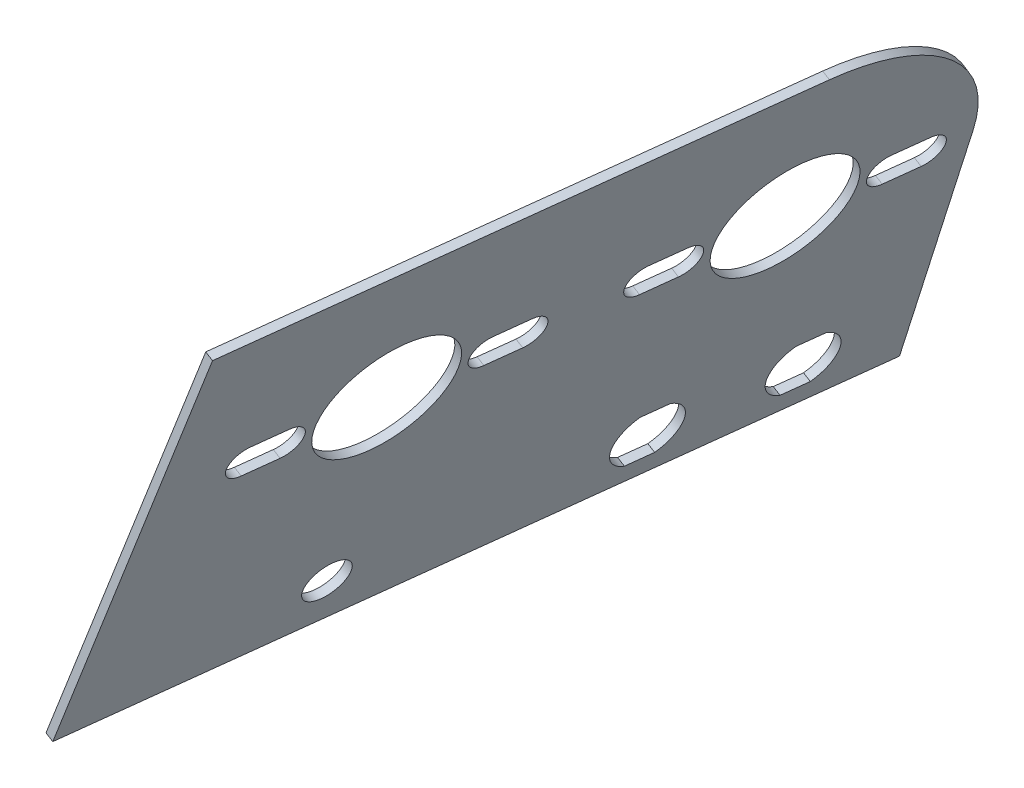
from build123d import *

# Parameters (mm, degrees)
SKETCH39_R          = 11.90625
SKETCH39_R_2        = 4.024999951
BOSS_EXTRUDE1_DEPTH = 1.5875


with BuildPart() as part:
    # Sketch39 → Boss-Extrude1 (new body)
    with BuildSketch(Plane(origin=(-441.521969452, 172.104793819, -62.182961286), x_dir=(-0.12122181659134341, 0.04725213510134498, 0.9915001295565519), z_dir=(-0.9237984742451071, 0.3600956621414251, -0.1301056996804562))):
        with BuildLine():
            Line((-228.044977909, 213.495528257), (-90.363815922, 201.963804234))
            Line((-90.363815922, 201.963804234), (-90.363815922, 283.724086083))
            Line((-90.363815922, 283.724086083), (-190.676741831, 292.125968815))
            ThreePointArc((-190.676741831, 292.125968815), (-213.041445426, 284.983204878), (-223.80498218, 264.11827449))
            Line((-223.80498218, 264.11827449), (-228.044977909, 213.495528257))
        make_face()
        with Locations((-128.463815922, 256.132810093)):
            Circle(SKETCH39_R, mode=Mode.SUBTRACT)
        with Locations((-193.237014843, 261.558001479)):
            Circle(SKETCH39_R, mode=Mode.SUBTRACT)
        with Locations((-131.908812452, 215.001828778)):
            Circle(SKETCH39_R_2, mode=Mode.SUBTRACT)
        with BuildLine():
            Line((-211.342041249, 227.174154397), (-206.415245302, 226.761502075))
            ThreePointArc((-206.415245302, 226.761502075), (-203.328738088, 220.983728264), (-207.333354614, 215.799883796))
            Line((-207.333354614, 215.799883796), (-212.260150561, 216.212536118))
            ThreePointArc((-212.260150561, 216.212536118), (-215.346657775, 221.990309928), (-211.342041249, 227.174154397))
        make_face(mode=Mode.SUBTRACT)
        with BuildLine():
            Line((-186.030668133, 225.054156527), (-181.103872186, 224.641504205))
            ThreePointArc((-181.103872186, 224.641504205), (-178.017364976, 218.8637304), (-182.021981496, 213.679885937))
            Line((-182.021981496, 213.679885937), (-186.948777443, 214.092538259))
            ThreePointArc((-186.948777443, 214.092538259), (-190.035284653, 219.870312063), (-186.030668133, 225.054156527))
        make_face(mode=Mode.SUBTRACT)
        with BuildLine():
            Line((-215.859429659, 266.728109418), (-209.53158638, 266.198109952))
            ThreePointArc((-209.53158638, 266.198109952), (-206.55149466, 262.673178781), (-210.076425831, 259.693087061))
            Line((-210.076425831, 259.693087061), (-216.40426911, 260.223086527))
            ThreePointArc((-216.40426911, 260.223086527), (-219.38436083, 263.748017698), (-215.859429659, 266.728109418))
        make_face(mode=Mode.SUBTRACT)
        with BuildLine():
            Line((-170.614600027, 256.387893539), (-176.942443306, 256.917893006))
            ThreePointArc((-176.942443306, 256.917893006), (-179.922535026, 260.442824177), (-176.397603855, 263.422915897))
            Line((-176.397603855, 263.422915897), (-170.069760576, 262.89291643))
            ThreePointArc((-170.069760576, 262.89291643), (-167.089668856, 259.367985259), (-170.614600027, 256.387893539))
        make_face(mode=Mode.SUBTRACT)
        with BuildLine():
            Line((-151.086230738, 261.302918032), (-144.758387459, 260.772918566))
            ThreePointArc((-144.758387459, 260.772918566), (-141.778295739, 257.247987395), (-145.30322691, 254.267895675))
            Line((-145.30322691, 254.267895675), (-151.631070189, 254.797895141))
            ThreePointArc((-151.631070189, 254.797895141), (-154.611161909, 258.322826312), (-151.086230738, 261.302918032))
        make_face(mode=Mode.SUBTRACT)
        with BuildLine():
            Line((-105.841401106, 250.962702154), (-112.169244385, 251.49270162))
            ThreePointArc((-112.169244385, 251.49270162), (-115.149336105, 255.017632791), (-111.624404934, 257.997724511))
            Line((-111.624404934, 257.997724511), (-105.296561655, 257.467725045))
            ThreePointArc((-105.296561655, 257.467725045), (-102.316469935, 253.942793873), (-105.841401106, 250.962702154))
        make_face(mode=Mode.SUBTRACT)
    extrude(amount=BOSS_EXTRUDE1_DEPTH)


solid = part.part
